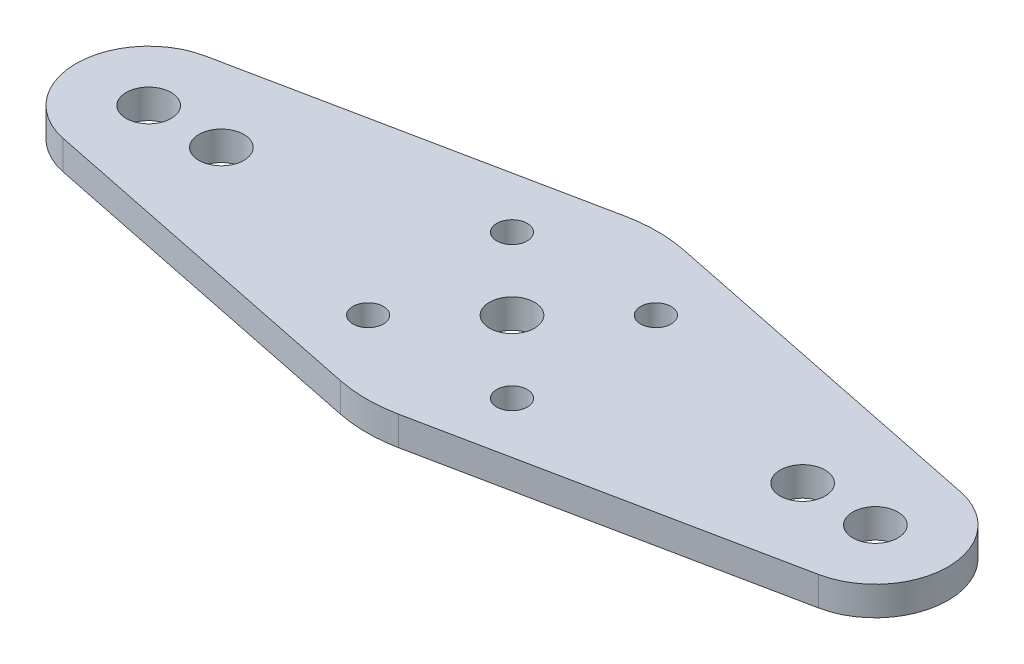
from build123d import *

# Parameters (mm, degrees)
SKETCH_1_R             = 2.1
SKETCH_1_R_2           = 3.1
SM_BASE_FLANGE_1_DEPTH = 4
SKETCH_6_R             = 3.1
CUT_EXTRUDE_1_DEPTH    = 10


# Sheet-metal steps are written as plain solids
with BuildPart() as part:
    # Sketch 1 → Базовая кромка1 (new body)
    with BuildSketch(Plane(origin=(0, 0, 0), x_dir=(1, 0, 0), z_dir=(0, 1, 0))):
        with BuildLine():
            Line((-52, 9.797958971), (-4, 19.595917942))
            ThreePointArc((-4, 19.595917942), (0, 20), (4, 19.595917942))
            Line((4, 19.595917942), (52, 9.797958971))
            ThreePointArc((52, 9.797958971), (60, 0), (52, -9.797958971))
            Line((52, -9.797958971), (4, -19.595917942))
            ThreePointArc((4, -19.595917942), (0, -20), (-4, -19.595917942))
            Line((-4, -19.595917942), (-52, -9.797958971))
            ThreePointArc((-52, -9.797958971), (-60, 0), (-52, 9.797958971))
        make_face()
        with Locations(Location((9.899494937, 9.899494937, 0), (0, 0, 270))):
            Circle(SKETCH_1_R, mode=Mode.SUBTRACT)
        with Locations(Location((9.899494937, -9.899494937, 0), (0, 0, 270))):
            Circle(SKETCH_1_R, mode=Mode.SUBTRACT)
        with Locations(Location((-9.899494937, -9.899494937, 0), (0, 0, 270))):
            Circle(SKETCH_1_R, mode=Mode.SUBTRACT)
        with Locations(Location((-9.899494937, 9.899494937, 0), (0, 0, 270))):
            Circle(SKETCH_1_R, mode=Mode.SUBTRACT)
        with Locations(Location((50, 0, 0), (0, 0, 270))):
            Circle(SKETCH_1_R_2, mode=Mode.SUBTRACT)
        with Locations(Location((-50, 0, 0), (0, 0, 270))):
            Circle(SKETCH_1_R_2, mode=Mode.SUBTRACT)
        with Locations(Location((-40, 0, 0), (0, 0, 270))):
            Circle(SKETCH_1_R_2, mode=Mode.SUBTRACT)
        with Locations(Location((40, 0, 0), (0, 0, 270))):
            Circle(SKETCH_1_R_2, mode=Mode.SUBTRACT)
    extrude(amount=-SM_BASE_FLANGE_1_DEPTH)

    # Эскиз6 → Вырез-Вытянуть1 (cut)
    with BuildSketch(Plane(origin=(0, 0, 0), x_dir=(1, 0, 0), z_dir=(0, 1, 0))):
        with Locations(Location((0, 0, 0), (0, 0, 270))):
            Circle(SKETCH_6_R)
    extrude(amount=-CUT_EXTRUDE_1_DEPTH, mode=Mode.SUBTRACT)


solid = part.part
